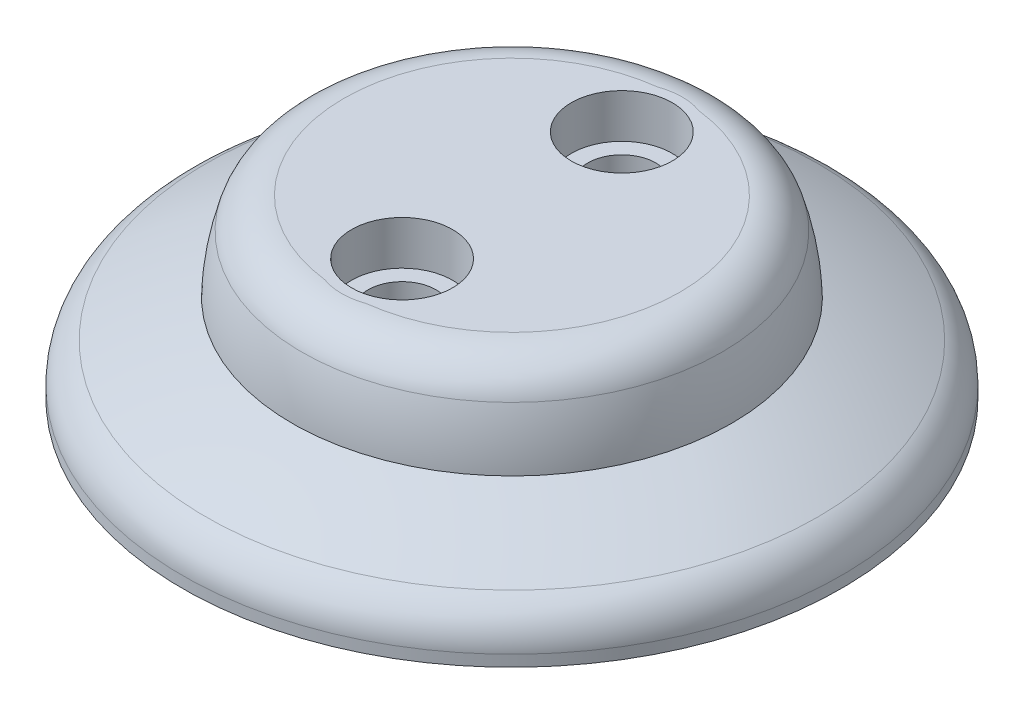
from build123d import *

# Parameters (mm, degrees)
CROQUIS6_R              = 14.5
CORTAR_EXTRUIR2_DEPTH   = 0.5
CROQUIS7_R              = 2.05
CROQUIS7_R_2            = 1.55
SALIENTE_EXTRUIR1_DEPTH = 6.5
CORTAR_EXTRUIR3_START   = -5.5
CROQUIS8_R              = 1.55
CORTAR_EXTRUIR3_DEPTH   = 5.5
REDONDEO1_R             = 2
REDONDEO2_R             = 2
CROQUIS9_R              = 2.75
CROQUIS9_R_2            = 1.55
SALIENTE_EXTRUIR2_DEPTH = 3
REDONDEO3_R             = 1
CROQUIS10_R             = 2.3
CORTAR_EXTRUIR6_DEPTH   = 2


with BuildPart() as part:
    # Croquis3 → Revolución1 (revolve)
    with BuildSketch(Plane.XY):
        with BuildLine():
            Line((15, 0), (15, 1.694213924))
            ThreePointArc((15, 1.694213924), (12.549846274, 2.962329925), (9.993557502, 4))
            ThreePointArc((9.993557502, 4), (9.70509179, 6.051742746), (9, 8))
            Line((9, 8), (0, 8))
            Line((0, 8), (0, 0))
            Line((0, 0), (15, 0))
        make_face()
    revolve(axis=Axis((0, 0, 0), (0, 1, 0)))

    # Croquis4 → Cortar-Revolución1 (revolve, cut)
    with BuildSketch(Plane.XY):
        with BuildLine():
            Line((0, 0.5), (0, 7.5))
            Line((0, 7.5), (8.680950348, 7.5))
            ThreePointArc((8.680950348, 7.5), (9.292895722, 5.613938885), (9.499999964, 3.641931911))
            ThreePointArc((9.499999964, 3.641931911), (12.052061122, 2.639235415), (14.5, 1.403916968))
            Line((14.5, 1.403916968), (14.5, 0.5))
            Line((14.5, 0.5), (0, 0.5))
        make_face()
    revolve(axis=Axis((0, 7.5, 0), (0, 1, 0)), mode=Mode.SUBTRACT)

    # Croquis6 → Cortar-Extruir2 (cut)
    with BuildSketch(Plane.XZ):
        Circle(CROQUIS6_R)
    extrude(amount=-CORTAR_EXTRUIR2_DEPTH, mode=Mode.SUBTRACT)

    # Croquis7 → Saliente-Extruir1 (add)
    # profile 1 of 2: a face of its own
    with BuildSketch(Plane.XZ.offset(-7.5)):
        with Locations(Location((0, 5, 0), (0, 0, 90))):
            Circle(CROQUIS7_R)
        with Locations(Location((0, 5, 0), (0, 0, 90))):
            Circle(CROQUIS7_R_2, mode=Mode.SUBTRACT)
    # profile 2 of 2: a face of its own
    with BuildSketch(Plane.XZ.offset(-7.5)):
        with Locations(Location((0, -5, 0), (0, 0, 90))):
            Circle(CROQUIS7_R)
        with Locations(Location((0, -5, 0), (0, 0, 90))):
            Circle(CROQUIS7_R_2, mode=Mode.SUBTRACT)
    extrude(amount=SALIENTE_EXTRUIR1_DEPTH)

    # Croquis8 → Cortar-Extruir3 (cut)
    with BuildSketch(Plane.XZ.offset(-7.5).offset(CORTAR_EXTRUIR3_START)):
        with Locations(Location((0, -5, 0), (0, 0, 90))):
            Circle(CROQUIS8_R)
        with Locations(Location((0, 5, 0), (0, 0, 90))):
            Circle(CROQUIS8_R)
    extrude(amount=CORTAR_EXTRUIR3_DEPTH, mode=Mode.SUBTRACT)

    # Redondeo1
    redondeo1_edges = [part.edges().sort_by_distance(p)[0] for p in [
        (-9, 8, 0),
    ]]
    fillet(redondeo1_edges, radius=REDONDEO1_R)

    # Redondeo2
    redondeo2_edges = [part.edges().sort_by_distance(p)[0] for p in [
        (-15, 1.694213924, 0),
    ]]
    fillet(redondeo2_edges, radius=REDONDEO2_R)

    # Croquis9 → Saliente-Extruir2 (add)
    # profile 1 of 2: a face of its own
    with BuildSketch(Plane(origin=(0, 8, 0), x_dir=(1, 0, 0), z_dir=(0, 1, 0))):
        with Locations(Location((0, 5, 0), (0, 0, 270))):
            Circle(CROQUIS9_R)
        with Locations(Location((0, 5, 0), (0, 0, 270))):
            Circle(CROQUIS9_R_2, mode=Mode.SUBTRACT)
    # profile 2 of 2: a face of its own
    with BuildSketch(Plane(origin=(0, 8, 0), x_dir=(1, 0, 0), z_dir=(0, 1, 0))):
        with Locations(Location((0, -5, 0), (0, 0, 270))):
            Circle(CROQUIS9_R)
        with Locations(Location((0, -5, 0), (0, 0, 270))):
            Circle(CROQUIS9_R_2, mode=Mode.SUBTRACT)
    extrude(amount=-SALIENTE_EXTRUIR2_DEPTH)

    # Redondeo3
    # the kernel refuses this fillet: 1 mm, written as the material it adds along each edge
    with BuildSketch(Plane(origin=(0, 5, -5), x_dir=(0, 0, 1), z_dir=(-1, 0, 0))) as redondeo3_piece_1:
        with BuildLine():
            CenterArc((3.05, -0.953939201), REDONDEO3_R, 107.457603124, 72.542396876)
            Line((2.75, 0), (2.744, 0.019078784))
            ThreePointArc((2.744, 0.019078784), (2.4, 0.02), (2.05, 0.02))
            Line((2.05, 0.02), (2.03, 0))
            Line((2.03, 0), (2.03, -0.953939201))
            Line((2.03, -0.953939201), (2.05, -0.953939201))
        make_face()
    revolve(axis=Axis((0, 5, -5), (0, 1, 0)))
    with BuildSketch(Plane(origin=(0, 5, 5), x_dir=(0, 0, 1), z_dir=(-1, 0, 0))) as redondeo3_piece_2:
        with BuildLine():
            CenterArc((3.05, -0.953939201), REDONDEO3_R, 107.457603124, 72.542396876)
            Line((2.05, -0.953939201), (2.03, -0.953939201))
            Line((2.03, -0.953939201), (2.03, 0))
            Line((2.03, 0), (2.05, 0.02))
            ThreePointArc((2.05, 0.02), (2.4, 0.02), (2.744, 0.019078784))
            Line((2.744, 0.019078784), (2.75, 0))
        make_face()
    revolve(axis=Axis((0, 5, 5), (0, 1, 0)))

    # Croquis10 → Cortar-Extruir6 (cut)
    with BuildSketch(Plane(origin=(0, 8, 0), x_dir=(1, 0, 0), z_dir=(0, 1, 0))):
        with Locations(Location((0, 5, 0), (0, 0, 270))):
            Circle(CROQUIS10_R)
        with Locations(Location((0, -5, 0), (0, 0, 270))):
            Circle(CROQUIS10_R)
    extrude(amount=-CORTAR_EXTRUIR6_DEPTH, mode=Mode.SUBTRACT)


solid = part.part
